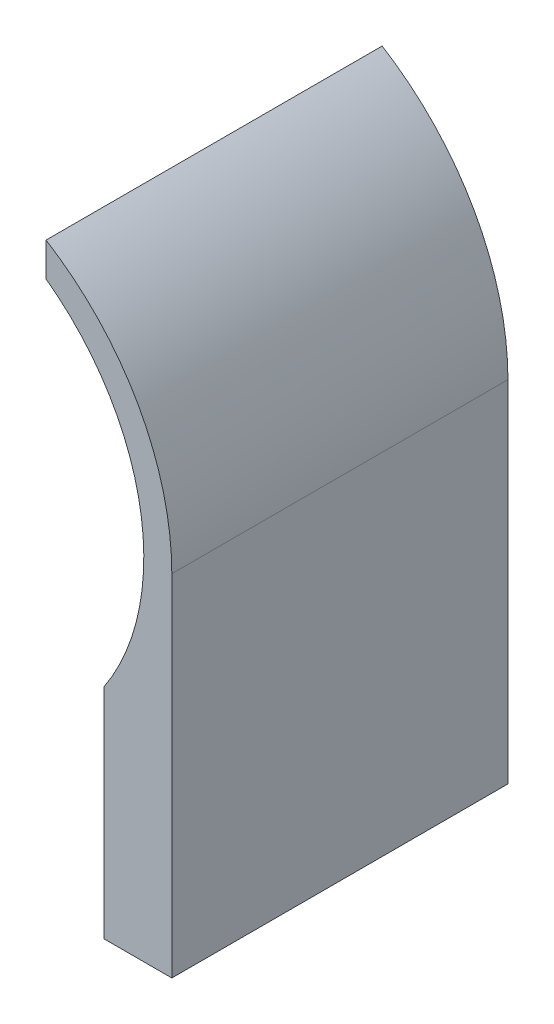
from build123d import *

# Parameters (mm, degrees)
INNER_RING_RIGHT_SIDE_DEPTH = 120


with BuildPart() as part:
    # Sketch2 → Inner Ring - Right Side (new body)
    with BuildSketch(Plane.XY):
        with BuildLine():
            Line((70.731226598, -47.139087644), (70.731226598, -125))
            Line((70.731226598, -125), (95, -125))
            Line((95, -125), (95, 0))
            ThreePointArc((95, 0), (83.019576005, 46.181706335), (50.1, 80.715487981))
            Line((50.1, 80.715487981), (50.1, 68.665784784))
            ThreePointArc((50.1, 68.665784784), (83.682366421, 14.908438891), (70.731226598, -47.139087644))
        make_face()
    extrude(amount=INNER_RING_RIGHT_SIDE_DEPTH)


solid = part.part
